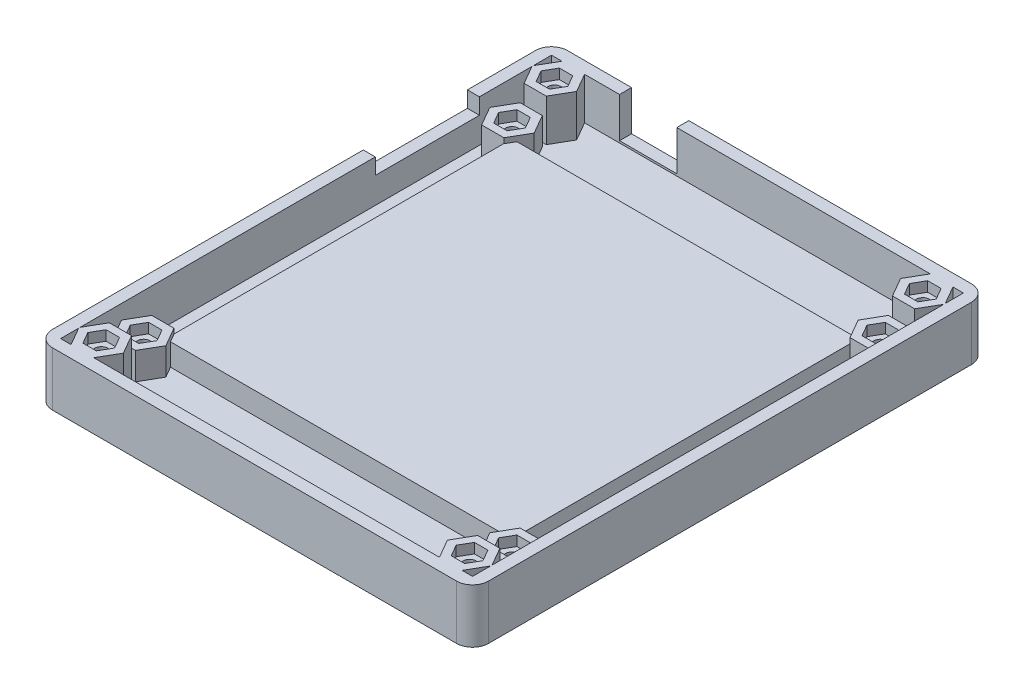
from build123d import *

# Parameters (mm, degrees)
P_IDAT_VYSUNUT_M25_DEPTH      = 3
P_IDAT_VYSUNUT_M26_DEPTH      = 10.5
P_IDAT_VYSUNUT_M26_DEPTH_BACK = 3
SKICA1_21_W                   = 108.885125168
SKICA1_21_H                   = 128.6
SKICA1_21_W_2                 = 102.885125168
SKICA1_21_H_2                 = 122.6
P_IDAT_VYSUNUT_M28_DEPTH      = 6.8
SKICA1_24_R                   = 1.6
P_IDAT_VYSUNUT_M29_DEPTH      = 4.3
LINPOLE3_COUNT                = 2
LINPOLE3_PITCH                = 92
LINPOLE3_COUNT_DIR2           = 2
LINPOLE3_PITCH_DIR2           = 92
P_IDAT_VYSUNUT_M30_DEPTH      = 10.5
SKICA1_26_R                   = 1.6
P_IDAT_VYSUNUT_M31_DEPTH      = 8
LINPOLE4_COUNT                = 2
LINPOLE4_PITCH                = 92
LINPOLE4_COUNT_DIR2           = 2
LINPOLE4_PITCH_DIR2           = 113.2
SKICA8_W                      = 86.538297386
SKICA8_H                      = 86.538297386
P_IDAT_VYSUNUT_M32_DEPTH      = 5.5
ZAOBLIT4_R                    = 4
SKICA9_W                      = 26
SKICA9_H                      = 4
ODEBRAT_VYSUNUT_M1_DEPTH      = 4
SKICA10_W                     = 14.3
SKICA10_H                     = 10
ODEBRAT_VYSUNUT_M2_DEPTH      = 5


with BuildPart() as part:
    # Skica1 → Přidat vysunutím25 (new body)
    with BuildSketch(Plane(origin=(0, 0, 0), x_dir=(1, 0, 0), z_dir=(0, 1, 0))):
        Polygon((51.442562584, 61.3), (-43.170983681, 61.3), (-43.228718708, 61.4), (-48.771281292, 61.4), (-48.829016319, 61.3), (-51.442562584, 61.3), (-51.442562584, 56.773205081), (-51.542562584, 56.6), (-51.442562584, 56.426794919), (-51.442562584, 46.173205081), (-51.542562584, 46), (-51.442562584, 45.826794919), (-51.442562584, -61.3), (51.442562584, -61.3), align=None)
    extrude(amount=-P_IDAT_VYSUNUT_M25_DEPTH)

    # Skica1<21> → Přidat vysunutím26 (add, two sides: drawn at the far end of the back side and taken through both)
    with BuildSketch(Plane(origin=(0, 0, 0), x_dir=(1, 0, 0), z_dir=(0, 1, 0)).offset(-P_IDAT_VYSUNUT_M26_DEPTH_BACK)):
        Rectangle(SKICA1_21_W, SKICA1_21_H)
        Rectangle(SKICA1_21_W_2, SKICA1_21_H_2, mode=Mode.SUBTRACT)
    extrude(amount=P_IDAT_VYSUNUT_M26_DEPTH + P_IDAT_VYSUNUT_M26_DEPTH_BACK)

    # Skica1<23> → Přidat vysunutím28 (add)
    with BuildSketch(Plane(origin=(0, 0, 0), x_dir=(1, 0, 0), z_dir=(0, 1, 0))):
        Polygon((-48.771281292, 41.2), (-43.228718708, 41.2), (-40.457437416, 46), (-43.228718708, 50.8), (-48.771281292, 50.8), (-51.542562584, 46), align=None)
        Polygon((-44.325684219, 43.1), (-47.674315781, 43.1), (-49.348631561, 46), (-47.674315781, 48.9), (-44.325684219, 48.9), (-42.651368439, 46), align=None, mode=Mode.SUBTRACT)
    p_idat_vysunut_m28 = extrude(amount=P_IDAT_VYSUNUT_M28_DEPTH)

    # Skica1<24> → Přidat vysunutím29 (add)
    with BuildSketch(Plane(origin=(0, 0, 0), x_dir=(1, 0, 0), z_dir=(0, 1, 0))):
        Polygon((-49.348631561, 46), (-47.674315781, 43.1), (-44.325684219, 43.1), (-42.651368439, 46), (-44.325684219, 48.9), (-47.674315781, 48.9), align=None)
        with Locations((-46, 46)):
            Circle(SKICA1_24_R, mode=Mode.SUBTRACT)
    p_idat_vysunut_m29 = extrude(amount=P_IDAT_VYSUNUT_M29_DEPTH)

    # LinPole3: Přidat vysunutím28, P_idat vysunut_m29 2 × 2
    with Locations(*[(i * LINPOLE3_PITCH, 0, j * LINPOLE3_PITCH_DIR2) for i in range(LINPOLE3_COUNT) for j in range(LINPOLE3_COUNT_DIR2) if (i, j) != (0, 0)]):
        add(p_idat_vysunut_m28)
        add(p_idat_vysunut_m29)

    # Skica1<25> → Přidat vysunutím30 (add)
    with BuildSketch(Plane(origin=(0, 0, 0), x_dir=(1, 0, 0), z_dir=(0, 1, 0))):
        Polygon((-51.542562584, 56.6), (-48.771281292, 51.8), (-43.228718708, 51.8), (-40.457437416, 56.6), (-43.228718708, 61.4), (-48.771281292, 61.4), align=None)
        Polygon((-44.325684219, 59.5), (-42.651368439, 56.6), (-44.325684219, 53.7), (-47.674315781, 53.7), (-49.348631561, 56.6), (-47.674315781, 59.5), align=None, mode=Mode.SUBTRACT)
    p_idat_vysunut_m30 = extrude(amount=P_IDAT_VYSUNUT_M30_DEPTH)

    # Skica1<26> → Přidat vysunutím31 (add)
    with BuildSketch(Plane(origin=(0, 0, 0), x_dir=(1, 0, 0), z_dir=(0, 1, 0))):
        Polygon((-44.325684219, 53.7), (-42.651368439, 56.6), (-44.325684219, 59.5), (-47.674315781, 59.5), (-49.348631561, 56.6), (-47.674315781, 53.7), align=None)
        with Locations((-46, 56.6)):
            Circle(SKICA1_26_R, mode=Mode.SUBTRACT)
    p_idat_vysunut_m31 = extrude(amount=P_IDAT_VYSUNUT_M31_DEPTH)

    # LinPole4: Přidat vysunutím30, P_idat vysunut_m31 2 × 2
    with Locations(*[(i * LINPOLE4_PITCH, 0, j * LINPOLE4_PITCH_DIR2) for i in range(LINPOLE4_COUNT) for j in range(LINPOLE4_COUNT_DIR2) if (i, j) != (0, 0)]):
        add(p_idat_vysunut_m30)
        add(p_idat_vysunut_m31)

    # Skica8 → Přidat vysunutím32 (add)
    with BuildSketch(Plane(origin=(0, 0, 0), x_dir=(1, 0, 0), z_dir=(0, 1, 0))):
        Rectangle(SKICA8_W, SKICA8_H)
    extrude(amount=P_IDAT_VYSUNUT_M32_DEPTH)

    # Zaoblit4
    zaoblit4_edges = [part.edges().sort_by_distance(p)[0] for p in [
        (-54.442562584, 3.75, 64.3),
        (54.442562584, 3.75, 64.3),
        (54.442562584, 3.75, -64.3),
        (-54.442562584, 3.75, -64.3),
    ]]
    fillet(zaoblit4_edges, radius=ZAOBLIT4_R)

    # Skica9 → Odebrat vysunutím1 (cut)
    with BuildSketch(Plane.ZY.offset(54.442562584)):
        with Locations((-30.3, 8.5)):
            Rectangle(SKICA9_W, SKICA9_H)
    extrude(amount=-ODEBRAT_VYSUNUT_M1_DEPTH, mode=Mode.SUBTRACT)

    # Skica10 → Odebrat vysunutím2 (cut)
    with BuildSketch(Plane(origin=(0, 0, -64.3), x_dir=(-1, 0, 0), z_dir=(0, 0, -1))):
        with Locations((27.292562584, 5.5)):
            Rectangle(SKICA10_W, SKICA10_H)
    extrude(amount=-ODEBRAT_VYSUNUT_M2_DEPTH, mode=Mode.SUBTRACT)


solid = part.part
